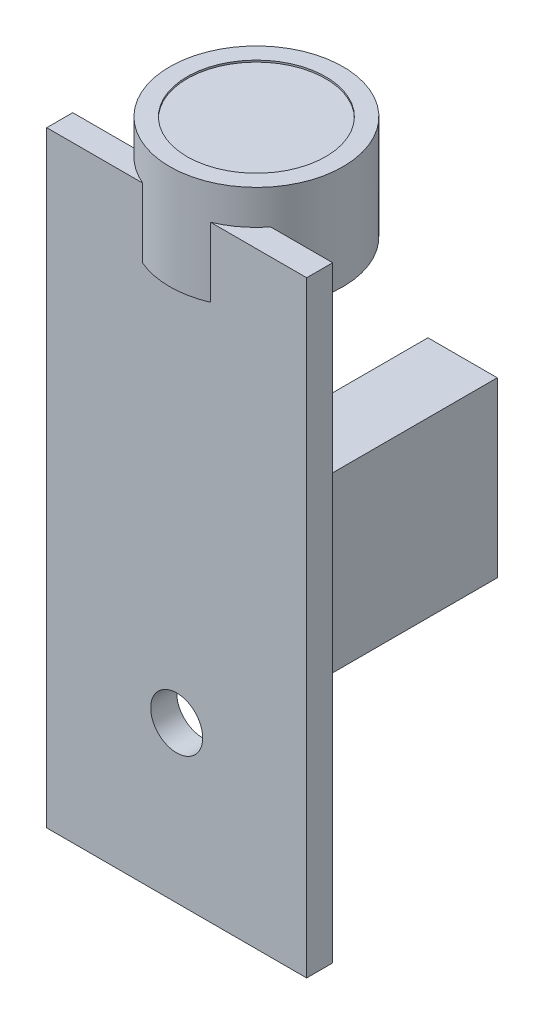
from build123d import *

# Parameters (mm, degrees)
SKETCH1_W                = 15
SKETCH1_H                = 35
SKETCH1_R                = 1.5
BOSS_EXTRUDE1_DEPTH      = 1.5
BOSS_EXTRUDE2_DEPTH      = 2
BOSS_EXTRUDE2_DEPTH_BACK = 4
SKETCH2_R                = 5
SKETCH3_R                = 4
CUT_EXTRUDE1_DEPTH       = 0.1
SKETCH4_W                = 4
SKETCH4_H                = 10
BOSS_EXTRUDE3_DEPTH      = 10


with BuildPart() as part:
    # Sketch1 → Boss-Extrude1 (new body)
    with BuildSketch(Plane.XY):
        with Locations((220.135234982, 151.894136477)):
            Rectangle(SKETCH1_W, SKETCH1_H)
        with Locations((220.135234982, 143.394136477)):
            Circle(SKETCH1_R, mode=Mode.SUBTRACT)
    extrude(amount=BOSS_EXTRUDE1_DEPTH)

    # Sketch2 → Boss-Extrude2 (add, two sides: drawn at the far end of the back side and taken through both)
    with BuildSketch(Plane(origin=(0, 169.394136477, 0), x_dir=(1, 0, 0), z_dir=(0, 1, 0)).offset(-BOSS_EXTRUDE2_DEPTH_BACK)):
        with Locations((220.135234982, 3.1)):
            Circle(SKETCH2_R)
    extrude(amount=BOSS_EXTRUDE2_DEPTH + BOSS_EXTRUDE2_DEPTH_BACK)

    # Sketch3 → Cut-Extrude1 (cut)
    with BuildSketch(Plane(origin=(0, 171.394136477, 0), x_dir=(1, 0, 0), z_dir=(0, 1, 0))):
        with Locations((220.135234982, 3.1)):
            Circle(SKETCH3_R)
    extrude(amount=-CUT_EXTRUDE1_DEPTH, mode=Mode.SUBTRACT)

    # Sketch4 → Boss-Extrude3 (add)
    with BuildSketch(Plane(origin=(0, 0, 0), x_dir=(-1, 0, 0), z_dir=(0, 0, -1))):
        with Locations((-225.135234982, 153.394136477)):
            Rectangle(SKETCH4_W, SKETCH4_H)
    extrude(amount=BOSS_EXTRUDE3_DEPTH)


solid = part.part
